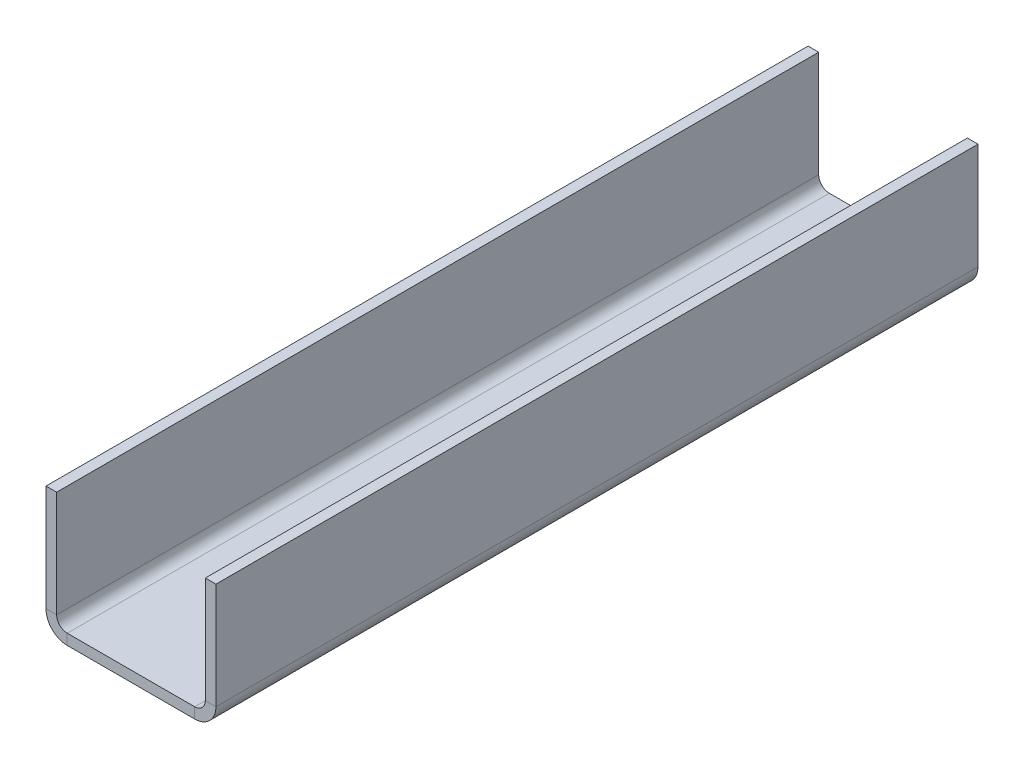
from build123d import *

# Parameters (mm, degrees)
BASE_FLANGE1_DEPTH = 227.838


# Sheet-metal steps are written as plain solids
with BuildPart() as part:
    # Base-Flange1: sheet metal written as solids
    # Sketch1 → Base-Flange1 (new body)
    with BuildSketch(Plane.XY):
        with BuildLine():
            Line((50.8, 38.1), (50.8, 6.35))
            ThreePointArc((50.8, 6.35), (48.940128061, 1.859871939), (44.45, 0))
            Line((44.45, 0), (6.35, 0))
            ThreePointArc((6.35, 0), (1.859871939, 1.859871939), (0, 6.35))
            Line((0, 6.35), (0, 38.1))
            Line((0, 38.1), (3.175, 38.1))
            Line((3.175, 38.1), (3.175, 6.35))
            ThreePointArc((3.175, 6.35), (4.10493597, 4.10493597), (6.35, 3.175))
            Line((6.35, 3.175), (44.45, 3.175))
            ThreePointArc((44.45, 3.175), (46.69506403, 4.10493597), (47.625, 6.35))
            Line((47.625, 6.35), (47.625, 38.1))
            Line((47.625, 38.1), (50.8, 38.1))
        make_face()
    extrude(amount=BASE_FLANGE1_DEPTH)


solid = part.part
